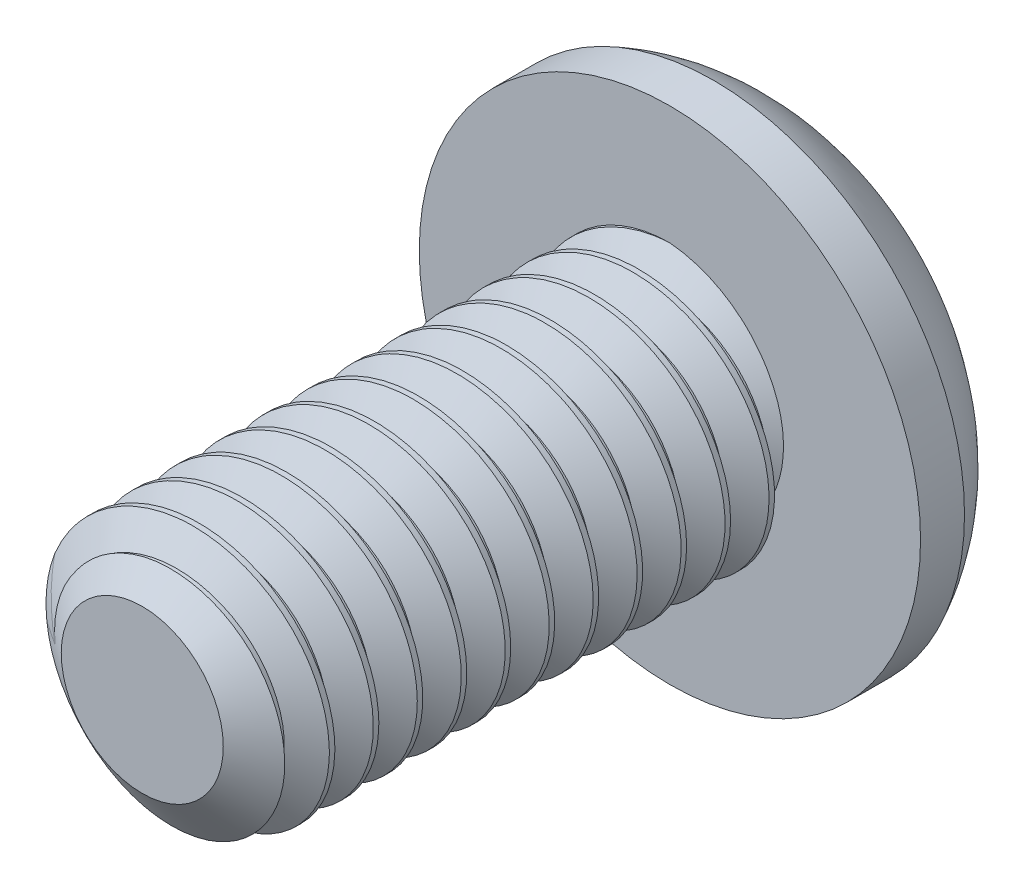
from build123d import *

# Parameters (mm, degrees)
SKETCH1_R          = 1.5
EXTRUDE1_DEPTH     = 6
CUT_SWEEP1_PITCH   = 0.5
SKETCH6_R          = 2.85
EXTRUDE2_DEPTH     = 1.65
CUT_EXTRUDE1_DEPTH = 1.5
SKETCH8_R          = 1.154700538
CUT_EXTRUDE2_DEPTH = 9.646820379
CUT_EXTRUDE2_TAPER = 45


with BuildPart() as part:
    # Sketch1 → Extrude1 (new body)
    with BuildSketch(Plane.XY):
        Circle(SKETCH1_R)
    extrude(amount=-EXTRUDE1_DEPTH)

    # Cut-Sweep1: the profile of Sketch3 profile screwed along a right-hand helix of 13 turns, 6 arcs to a turn; built about Z, then put on its axis
    cut_sweep1_z = Axis((0, 0, 0), (0, 0, 1))
    cut_sweep1_corners = [(1.5003, 0, -0.437673205), (1.175240474, 0, -0.25), (1.175240474, 0, -0.1875), (1.5003, 0, 0.000173205)]
    with BuildLine(mode=Mode.PRIVATE) as cut_sweep1_profile:
        Line(cut_sweep1_corners[0], cut_sweep1_corners[1])
        Line(cut_sweep1_corners[1], cut_sweep1_corners[2])
        Line(cut_sweep1_corners[2], cut_sweep1_corners[3])
        Line(cut_sweep1_corners[3], cut_sweep1_corners[0])
    cut_sweep1_cap = Face(cut_sweep1_profile.wire())
    cut_sweep1_turn_angles = [0, 30, 60, 90, 120, 150, 180, 210, 240, 270, 300, 330, 360]
    cut_sweep1_turn_weights = [1, 0.8660254037844387, 1, 0.8660254037844387, 1, 0.8660254037844387, 1, 0.8660254037844387, 1, 0.8660254037844387, 1, 0.8660254037844387, 1]
    cut_sweep1_turn_rails = [Edge.make_bspline([Vector(p[0], p[1], 0).rotate(cut_sweep1_z, cut_sweep1_turn_angles[k]) / cut_sweep1_turn_weights[k] + Vector(0, 0, p[2] + CUT_SWEEP1_PITCH * cut_sweep1_turn_angles[k] / 360) for k in range(13)], [0, 0, 0, 1, 1, 2, 2, 3, 3, 4, 4, 5, 5, 6, 6, 6], 2, cut_sweep1_turn_weights) for p in cut_sweep1_corners]
    cut_sweep1_turn_sides = [Face.make_surface_from_curves(cut_sweep1_turn_rails[p[0]], cut_sweep1_turn_rails[p[1]]) for p in [(0, 1), (1, 2), (2, 3), (3, 0)]]
    cut_sweep1 = Plane(origin=(0, 0, 0), x_dir=(0, 1, 0), z_dir=(0, 0, -1)) * Solid(Shell([*[p.moved(Location((0, 0, CUT_SWEEP1_PITCH * i))) for i in range(13) for p in cut_sweep1_turn_sides], cut_sweep1_cap, cut_sweep1_cap.rotate(cut_sweep1_z, 4680).moved(Location((0, 0, CUT_SWEEP1_PITCH * 4680 / 360)))]))
    add(cut_sweep1, mode=Mode.SUBTRACT)

    # Sketch4 → Cut-Revolve1 (revolve, cut)
    with BuildSketch(Plane(origin=(0, 0, 0), x_dir=(0, 0, -1), z_dir=(1, 0, 0)), mode=Mode.PRIVATE) as cut_revolve1_sk:
        Polygon((0.405251783, 1.5), (0, 0.921240474), (0, 1.5), align=None)
    revolve(cut_revolve1_sk.sketch.rotate(Axis((0, 0, 0), (0, 0, -1)), 263.352109169), axis=Axis((0, 0, 0), (0, 0, -1)), mode=Mode.SUBTRACT)

    # Sketch6 → Extrude2 (add)
    with BuildSketch(Plane(origin=(0, 0, -6), x_dir=(-1, 0, 0), z_dir=(0, 0, -1))):
        Circle(SKETCH6_R)
    extrude(amount=EXTRUDE2_DEPTH)

    # Sketch10 → Cut-Revolve2 (revolve, cut)
    with BuildSketch(Plane(origin=(0, 0, 0), x_dir=(0, 0, -1), z_dir=(1, 0, 0)), mode=Mode.PRIVATE) as cut_revolve2_sk:
        with BuildLine():
            Line((6.5, 2.85), (6.5, 3.35))
            Line((6.5, 3.35), (8.15, 3.35))
            Line((8.15, 3.35), (8.15, 1))
            Line((8.15, 1), (7.65, 1))
            ThreePointArc((7.65, 1), (7.339069073, 2.089151046), (6.5, 2.85))
        make_face()
    revolve(cut_revolve2_sk.sketch.rotate(Axis((0, 0, 0), (0, 0, -1)), 90), axis=Axis((0, 0, 0), (0, 0, -1)), mode=Mode.SUBTRACT)

    # Sketch7 → Cut-Extrude1 (cut)
    with BuildSketch(Plane(origin=(0, 0, -7.65), x_dir=(-1, 0, 0), z_dir=(0, 0, -1))):
        Polygon((0, 1.154700538), (-1, 0.577350269), (-1, -0.577350269), (0, -1.154700538), (1, -0.577350269), (1, 0.577350269), align=None)
    extrude(amount=-CUT_EXTRUDE1_DEPTH, mode=Mode.SUBTRACT)

    # Sketch8 → Cut-Extrude2 (cut, through all)
    with BuildSketch(Plane.XY.offset(-7.65)):
        Circle(SKETCH8_R)
    extrude(amount=CUT_EXTRUDE2_DEPTH, taper=CUT_EXTRUDE2_TAPER, mode=Mode.SUBTRACT)


solid = part.part
